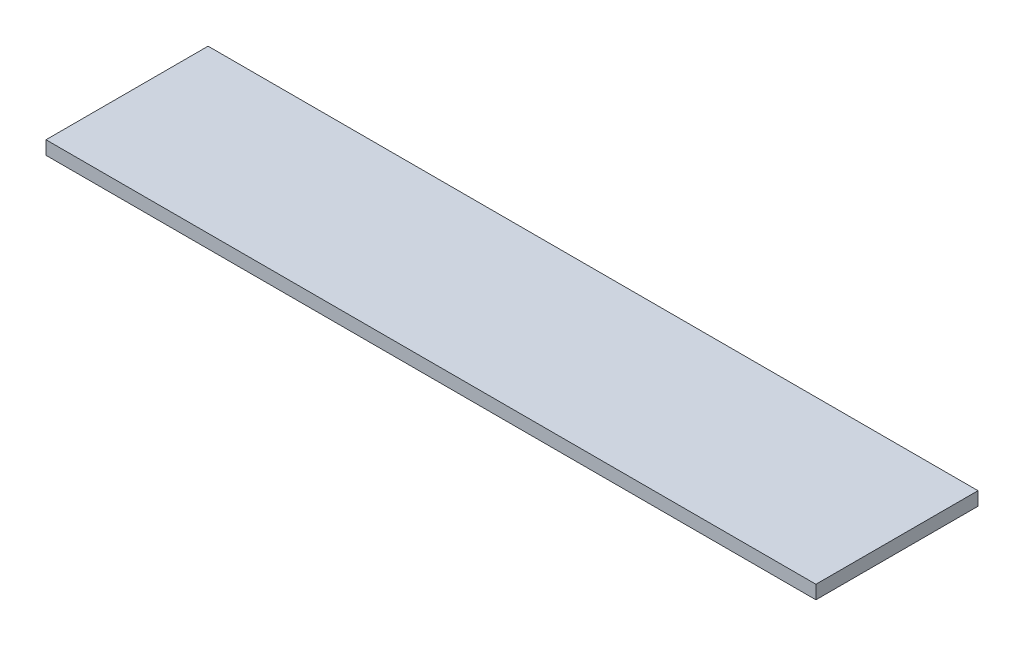
from build123d import *

# Parameters (mm, degrees)
SKETCH1_W           = 723.9
SKETCH1_H           = 152.4
BOSS_EXTRUDE1_DEPTH = 12.7


with BuildPart() as part:
    # Sketch1 → Boss-Extrude1 (new body)
    with BuildSketch(Plane(origin=(0, 0, 0), x_dir=(1, 0, 0), z_dir=(0, 1, 0))):
        with Locations((66.351143947, 109.566253575)):
            Rectangle(SKETCH1_W, SKETCH1_H)
    extrude(amount=BOSS_EXTRUDE1_DEPTH)


solid = part.part
